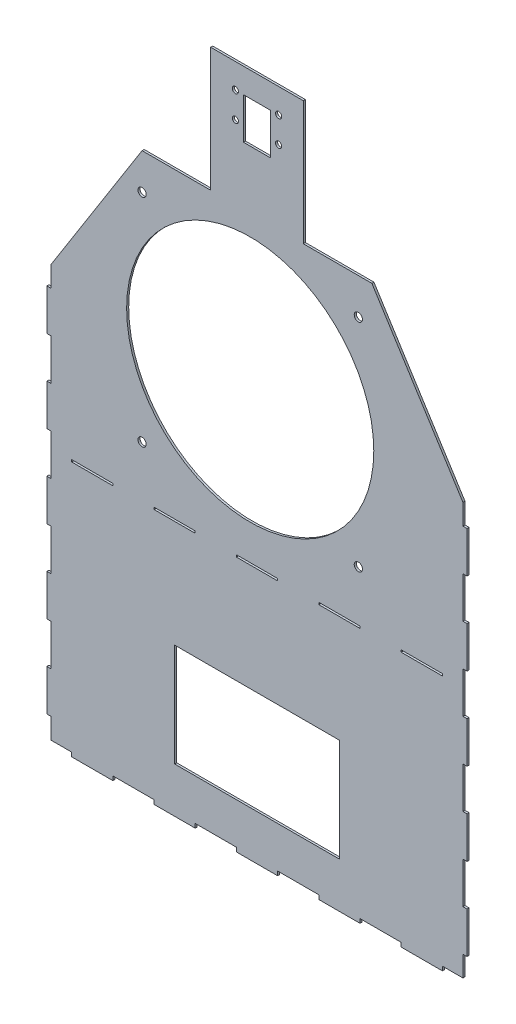
from build123d import *

# Parameters (mm, degrees)
SKICA1_W                = 20
SKICA1_H                = 1
SKICA1_R                = 2
SKICA1_W_2              = 80
SKICA1_H_2              = 50
SKICA1_R_2              = 60
SKICA1_R_3              = 1.5
SKICA1_W_3              = 13
SKICA1_H_3              = 20
P_IDAT_VYSUNUT_M1_DEPTH = 1


with BuildPart() as part:
    # Skica1 → Přidat vysunutím1 (new body)
    with BuildSketch(Plane.XY):
        Polygon((-124.598141023, -103.240049383), (-124.598141023, -113.240049383), (-114.598141023, -113.240049383), (-114.598141023, -115.240049383), (-94.598141023, -115.240049383), (-94.598141023, -113.240049383), (-74.598141023, -113.240049383), (-74.598141023, -115.240049383), (-54.598141023, -115.240049383), (-54.598141023, -113.240049383), (-34.598141023, -113.240049383), (-34.598141023, -115.240049383), (-14.598141023, -115.240049383), (-14.598141023, -113.240049383), (5.401858977, -113.240049383), (5.401858977, -115.240049383), (25.401858977, -115.240049383), (25.401858977, -113.240049383), (45.401858977, -113.240049383), (45.401858977, -115.240049383), (65.401858977, -115.240049383), (65.401858977, -113.240049383), (75.401858977, -113.240049383), (75.401858977, -103.240049383), (77.401858977, -103.240049383), (77.401858977, -83.240049383), (75.401858977, -83.240049383), (75.401858977, -63.240049383), (77.401858977, -63.240049383), (77.401858977, -43.240049383), (75.401858977, -43.240049383), (75.401858977, -23.240049383), (77.401858977, -23.240049383), (77.401858977, -3.240049383), (75.401858977, -3.240049383), (75.401858977, 16.759950617), (77.401858977, 16.759950617), (77.401858977, 36.759950617), (75.401858977, 36.759950617), (75.401858977, 56.759950617), (77.401858977, 56.759950617), (77.401858977, 76.759950617), (75.401858977, 76.759950617), (75.401858977, 86.759950617), (31.183586154, 156.759950617), (-2.098141023, 156.759950617), (-2.098141023, 216.89905968), (-47.098141023, 216.89905968), (-47.098141023, 156.759950617), (-80.379868199, 156.759950617), (-124.598141023, 86.759950617), (-124.598141023, 76.759950617), (-126.598141023, 76.759950617), (-126.598141023, 56.759950617), (-124.598141023, 56.759950617), (-124.598141023, 36.759950617), (-126.598141023, 36.759950617), (-126.598141023, 16.759950617), (-124.598141023, 16.759950617), (-124.598141023, -3.240049383), (-126.598141023, -3.240049383), (-126.598141023, -23.240049383), (-124.598141023, -23.240049383), (-124.598141023, -43.240049383), (-126.598141023, -43.240049383), (-126.598141023, -63.240049383), (-124.598141023, -63.240049383), (-124.598141023, -83.240049383), (-126.598141023, -83.240049383), (-126.598141023, -103.240049383), align=None)
        with Locations((-104.598141023, 9.259950617)):
            Rectangle(SKICA1_W, SKICA1_H, mode=Mode.SUBTRACT)
        with Locations((-80.379868199, 34.259950617)):
            Circle(SKICA1_R, mode=Mode.SUBTRACT)
        with Locations((-64.598141023, 9.259950617)):
            Rectangle(SKICA1_W, SKICA1_H, mode=Mode.SUBTRACT)
        with Locations((-24.598141023, -68.240049383)):
            Rectangle(SKICA1_W_2, SKICA1_H_2, mode=Mode.SUBTRACT)
        with Locations((-24.598141023, 9.259950617)):
            Rectangle(SKICA1_W, SKICA1_H, mode=Mode.SUBTRACT)
        with Locations((15.401858977, 9.259950617)):
            Rectangle(SKICA1_W, SKICA1_H, mode=Mode.SUBTRACT)
        with Locations((24.620131801, 34.259950617)):
            Circle(SKICA1_R, mode=Mode.SUBTRACT)
        with Locations((55.401858977, 9.259950617)):
            Rectangle(SKICA1_W, SKICA1_H, mode=Mode.SUBTRACT)
        with Locations((-27.879868199, 86.759950617)):
            Circle(SKICA1_R_2, mode=Mode.SUBTRACT)
        with Locations((-80.379868199, 139.259950617)):
            Circle(SKICA1_R, mode=Mode.SUBTRACT)
        with Locations((24.620131801, 139.259950617)):
            Circle(SKICA1_R, mode=Mode.SUBTRACT)
        with Locations((-14.098141023, 204.89905968)):
            Circle(SKICA1_R_3, mode=Mode.SUBTRACT)
        with Locations((-35.098141023, 192.39905968)):
            Circle(SKICA1_R_3, mode=Mode.SUBTRACT)
        with Locations((-35.098141023, 204.89905968)):
            Circle(SKICA1_R_3, mode=Mode.SUBTRACT)
        with Locations((-24.598141023, 194.89905968)):
            Rectangle(SKICA1_W_3, SKICA1_H_3, mode=Mode.SUBTRACT)
        with Locations((-14.098141023, 192.39905968)):
            Circle(SKICA1_R_3, mode=Mode.SUBTRACT)
    extrude(amount=P_IDAT_VYSUNUT_M1_DEPTH)


solid = part.part
